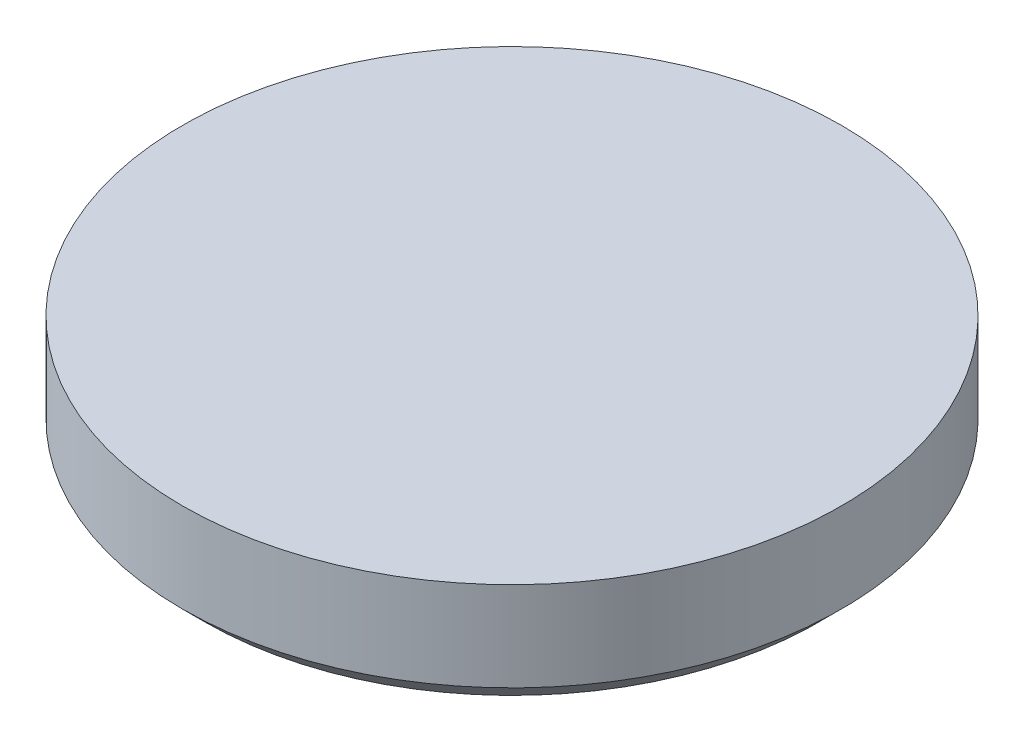
from build123d import *

# Parameters (mm, degrees)
SKETCH1_R                      = 37.465
BOSS_EXTRUDE1_DEPTH            = 12.7
M3_CLEARANCE_HOLE1_D           = 3.4
M3_CLEARANCE_HOLE1_DEPTH       = 9.525
M3_CLEARANCE_HOLE1_CSINK_D     = 3.45
M3_CLEARANCE_HOLE1_CSINK_ANGLE = 90
M3_CLEARANCE_HOLE1_TIP         = 1.021463052
THREAD1_PITCH                  = 0.5
CHAMFER1_SIZE                  = 2.54


with BuildPart() as part:
    # Sketch1 → Boss-Extrude1 (new body)
    with BuildSketch(Plane(origin=(0, 0, 0), x_dir=(1, 0, 0), z_dir=(0, 1, 0))):
        with Locations(Location((0, 0, 0), (0, 0, 270))):
            Circle(SKETCH1_R)
    extrude(amount=BOSS_EXTRUDE1_DEPTH)

    # M3 Clearance Hole1
    with Locations(Plane(origin=(0, 0, 0), x_dir=(-1, 0, 0), z_dir=(0, -1, 0))):
        with Locations((0, 0)):
            CounterSinkHole(M3_CLEARANCE_HOLE1_D / 2, M3_CLEARANCE_HOLE1_CSINK_D / 2, depth=M3_CLEARANCE_HOLE1_DEPTH, counter_sink_angle=M3_CLEARANCE_HOLE1_CSINK_ANGLE)
            with Locations((0, 0, -(M3_CLEARANCE_HOLE1_DEPTH + M3_CLEARANCE_HOLE1_TIP / 2))):  # 118° drill point
                Cone(0, M3_CLEARANCE_HOLE1_D / 2, M3_CLEARANCE_HOLE1_TIP, mode=Mode.SUBTRACT)

    # Thread1: the profile of Thread Profile1 profile screwed along a right-hand helix of 20 turns, 6 arcs to a turn; built about Z, then put on its axis
    thread1_z = Axis((0, 0, 0), (0, 0, 1))
    thread1_corners = [(1.7003, 0, -0.000173205), (1.7003, 0, 0.437673204), (1.429367062, 0, 0.281249999), (1.429367062, 0, 0.156249999)]
    with BuildLine(mode=Mode.PRIVATE) as thread1_profile:
        Line(thread1_corners[0], thread1_corners[1])
        Line(thread1_corners[1], thread1_corners[2])
        Line(thread1_corners[2], thread1_corners[3])
        Line(thread1_corners[3], thread1_corners[0])
    thread1_cap = Face(thread1_profile.wire())
    thread1_turn_angles = [0, 30, 60, 90, 120, 150, 180, 210, 240, 270, 300, 330, 360]
    thread1_turn_weights = [1, 0.8660254037844387, 1, 0.8660254037844387, 1, 0.8660254037844387, 1, 0.8660254037844387, 1, 0.8660254037844387, 1, 0.8660254037844387, 1]
    thread1_turn_rails = [Edge.make_bspline([Vector(p[0], p[1], 0).rotate(thread1_z, thread1_turn_angles[k]) / thread1_turn_weights[k] + Vector(0, 0, p[2] + THREAD1_PITCH * thread1_turn_angles[k] / 360) for k in range(13)], [0, 0, 0, 1, 1, 2, 2, 3, 3, 4, 4, 5, 5, 6, 6, 6], 2, thread1_turn_weights) for p in thread1_corners]
    thread1_turn_sides = [Face.make_surface_from_curves(thread1_turn_rails[p[0]], thread1_turn_rails[p[1]]) for p in [(0, 1), (1, 2), (2, 3), (3, 0)]]
    thread1 = Plane(origin=(0, 0.025, 0), x_dir=(1, 0, 0), z_dir=(0, 1, 0)) * Solid(Shell([*[p.moved(Location((0, 0, THREAD1_PITCH * i))) for i in range(20) for p in thread1_turn_sides], thread1_cap, thread1_cap.rotate(thread1_z, 7200).moved(Location((0, 0, THREAD1_PITCH * 7200 / 360)))]))
    add(thread1)

    # Chamfer1
    chamfer1_edges = [part.edges().sort_by_distance(p)[0] for p in [
        (0, 0, -37.465),
    ]]
    chamfer(chamfer1_edges, length=CHAMFER1_SIZE)


solid = part.part
